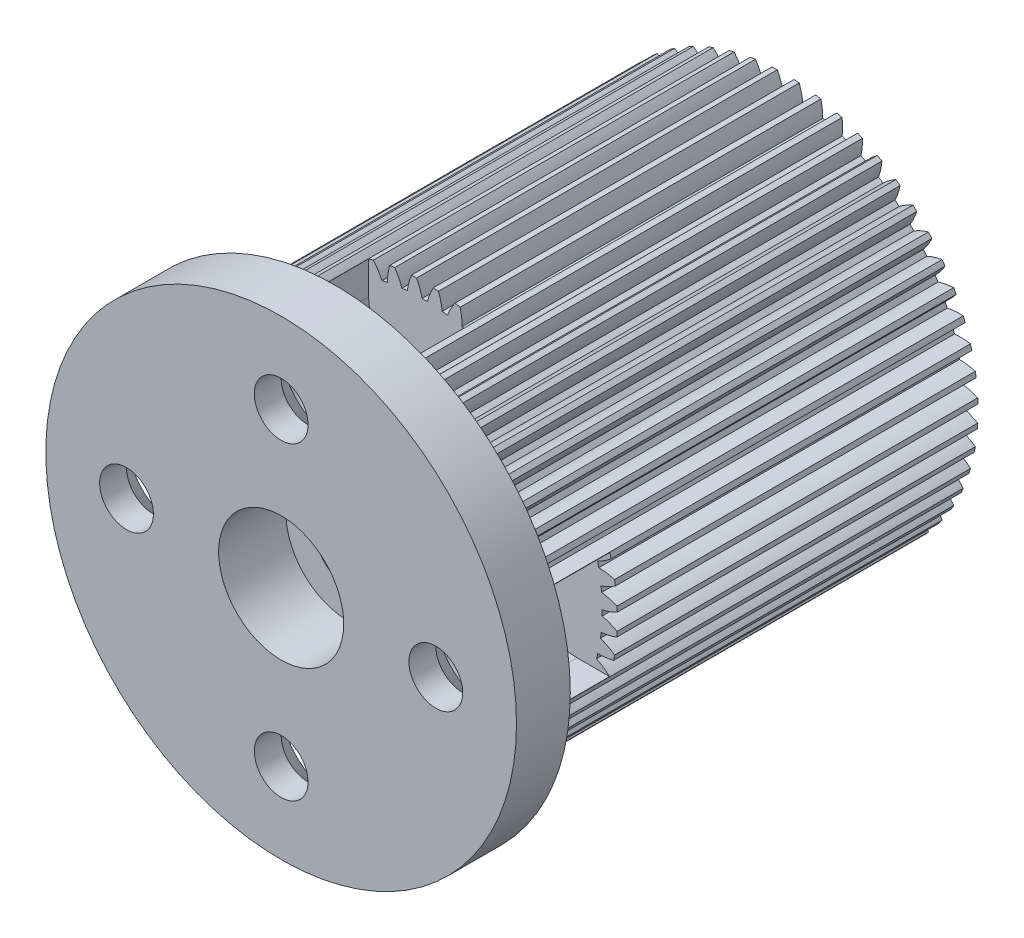
from build123d import *

# Parameters (mm, degrees)
SKETCH1_R           = 14.5
BOSS_EXTRUDE1_DEPTH = 16.661690565
CUT_EXTRUDE1_DEPTH  = 27.421807896
CIRPATTERN2_COUNT   = 56
SKETCH3_W           = 17.5
SKETCH3_H           = 4
CHAMFER1_SIZE       = 0.5
CHAMFER2_SIZE       = 0.5
SKETCH4_R           = 2.5
CUT_EXTRUDE2_DEPTH  = 51.328806271
SKETCH5_R           = 4.65
CUT_EXTRUDE3_DEPTH  = 5
SKETCH6_R           = 2
CUT_EXTRUDE4_DEPTH  = 47.887116478
CIRPATTERN3_COUNT   = 4
CUT_EXTRUDE9_DEPTH  = 6.5
CIRPATTERN4_COUNT   = 4


with BuildPart() as part:
    # Sketch1 → Boss-Extrude1 (new, symmetric)
    with BuildSketch(Plane.XY):
        Circle(SKETCH1_R)
    extrude(amount=BOSS_EXTRUDE1_DEPTH, both=True)

    # Sketch2 → Cut-Extrude1 (cut, symmetric)
    with BuildSketch(Plane.XY):
        with BuildLine():
            ThreePointArc((13.374972872, 0.026938295), (13.374993218, 0.013469154), (13.375, 0))
            ThreePointArc((13.375, 0), (13.37384438, -0.175816675), (13.370377719, -0.351602969))
            ThreePointArc((13.370377719, -0.351602969), (13.370016861, -0.36506729), (13.369642445, -0.378531241))
            add(Edge.make_bspline(
                [(13.369642445, -0.378531241), (13.390928425, -0.383060658), (13.434491441, -0.392881127), (13.500038107, -0.409193304), (13.587134794, -0.433619895), (13.674599675, -0.460663373), (13.761421833, -0.489861282), (13.847500801, -0.520944712), (13.951247766, -0.560946326), (14.074899689, -0.612172445), (14.218235723, -0.676764692), (14.342643779, -0.737625304), (14.42842691, -0.782072845), (14.473174045, -0.805878272), (14.477460763, -0.808164492)],
                knots=[0.066092985, 0.066092985, 0.066092985, 0.066092985, 0.066092985, 0.092110525, 0.119476176, 0.146842496, 0.174208854, 0.201574956, 0.228941013, 0.256307345, 0.307035032, 0.361767352, 0.416499661, 0.422302771, 0.422302771, 0.422302771, 0.422302771, 0.422302771], degree=4))
            ThreePointArc((14.477460763, -0.808164492), (14.494364096, -0.404239367), (14.5, 0))
            ThreePointArc((14.5, 0), (14.498425557, 0.213673531), (14.493702569, 0.427300661))
            add(Edge.make_bspline(
                [(13.374972872, 0.026938295), (13.396370566, 0.030906579), (13.440176688, 0.039578467), (13.506129518, 0.054161911), (13.593838233, 0.076290457), (13.681983808, 0.101025306), (13.769543517, 0.127930736), (13.85640986, 0.156740574), (13.961172537, 0.194001056), (14.086128362, 0.241958902), (14.231112867, 0.302760797), (14.357077837, 0.360329929), (14.443999762, 0.402507037), (14.489357231, 0.425127921), (14.493702569, 0.427300661)],
                knots=[0.066092985, 0.066092985, 0.066092985, 0.066092985, 0.066092985, 0.092110525, 0.119476176, 0.146842496, 0.174208854, 0.201574956, 0.228941013, 0.256307345, 0.307035032, 0.361767352, 0.416499661, 0.422302771, 0.422302771, 0.422302771, 0.422302771, 0.422302771], degree=4))
        make_face()
    cut_extrude1 = extrude(amount=CUT_EXTRUDE1_DEPTH, both=True, mode=Mode.SUBTRACT)

    # CirPattern2: Cut-Extrude1 ×56 about axis
    cirpattern2_axis = Axis((0, 0, -16.661690565), (0, 0, 1))
    for i in range(1, CIRPATTERN2_COUNT):
        add(cut_extrude1.rotate(cirpattern2_axis, i * 360 / CIRPATTERN2_COUNT), mode=Mode.SUBTRACT)

    # Sketch3 → Revolve1 (revolve)
    with BuildSketch(Plane(origin=(0, 0, 0), x_dir=(1, 0, 0), z_dir=(0, 1, 0))):
        Polygon((0, 16.661690565), (0, 23.161690565), (-4, 23.161690565), (-4, 18.161690565), (-4.5, 18.161690565), (-4.5, 16.661690565), align=None)
        with Locations((-8.75, -18.661690565)):
            Rectangle(SKETCH3_W, SKETCH3_H)
    revolve(axis=Axis((0, 0, -16.661690565), (0, 0, -1)))

    # Chamfer1
    chamfer1_edges = [part.edges().sort_by_distance(p)[0] for p in [
        (4.5, 0, -16.661690565),
    ]]
    chamfer(chamfer1_edges, length=CHAMFER1_SIZE)

    # Chamfer2
    chamfer2_edges = [part.edges().sort_by_distance(p)[0] for p in [
        (4, 0, -23.161690565),
    ]]
    chamfer(chamfer2_edges, length=CHAMFER2_SIZE)

    # Sketch4 → Cut-Extrude2 (cut, through all)
    with BuildSketch(Plane.XY.offset(20.661690565)):
        Circle(SKETCH4_R)
    extrude(amount=-CUT_EXTRUDE2_DEPTH, mode=Mode.SUBTRACT)

    # Sketch5 → Cut-Extrude3 (cut)
    with BuildSketch(Plane.XY.offset(20.661690565)):
        Circle(SKETCH5_R)
    extrude(amount=-CUT_EXTRUDE3_DEPTH, mode=Mode.SUBTRACT)

    # Sketch6 → Cut-Extrude4 (cut, through all)
    with BuildSketch(Plane(origin=(0, 0, 16.661690565), x_dir=(-1, 0, 0), z_dir=(0, 0, -1))):
        with Locations((0, 11.5)):
            Circle(SKETCH6_R)
        with Locations((11.5, 0)):
            Circle(SKETCH6_R)
        with Locations((0, -11.5)):
            Circle(SKETCH6_R)
        with Locations((-11.5, 0)):
            Circle(SKETCH6_R)
    extrude(amount=-CUT_EXTRUDE4_DEPTH, mode=Mode.SUBTRACT)

    # Sketch7 → Cut-Revolve1 (revolve, cut)
    with BuildSketch(Plane(origin=(0, 0, 0), x_dir=(1, 0, 0), z_dir=(0, 1, 0))):
        Polygon((15.5, -16.661690565), (11.5, -16.661690565), (11.5, -18.661690565), (13.5, -18.661690565), align=None)
    cut_revolve1 = revolve(axis=Axis((11.5, 0, 16.661690565), (0, 0, 1)), mode=Mode.SUBTRACT)

    # CirPattern3: Cut-Revolve1 ×4 about axis
    cirpattern3_axis = Axis((0, 0, -23.161690565), (0, 0, 1))
    for i in range(1, CIRPATTERN3_COUNT):
        add(cut_revolve1.rotate(cirpattern3_axis, i * 360 / CIRPATTERN3_COUNT), mode=Mode.SUBTRACT)

    # Sketch8 → Cut-Extrude9 (cut)
    with BuildSketch(Plane(origin=(0, 0, 16.661690565), x_dir=(-1, 0, 0), z_dir=(0, 0, -1))):
        with BuildLine():
            Line((-4, 14.974979132), (-4, 11.5))
            ThreePointArc((-4, 11.5), (0, 7.5), (4, 11.5))
            Line((4, 11.5), (4, 14.974979132))
            ThreePointArc((4, 14.974979132), (0, 15.5), (-4, 14.974979132))
        make_face()
    cut_extrude9 = extrude(amount=CUT_EXTRUDE9_DEPTH, mode=Mode.SUBTRACT)

    # CirPattern4: Cut-Extrude9 ×4 about axis
    cirpattern4_axis = Axis((0, 0, -16.661690565), (0, 0, 1))
    for i in range(1, CIRPATTERN4_COUNT):
        add(cut_extrude9.rotate(cirpattern4_axis, i * 360 / CIRPATTERN4_COUNT), mode=Mode.SUBTRACT)


solid = part.part
